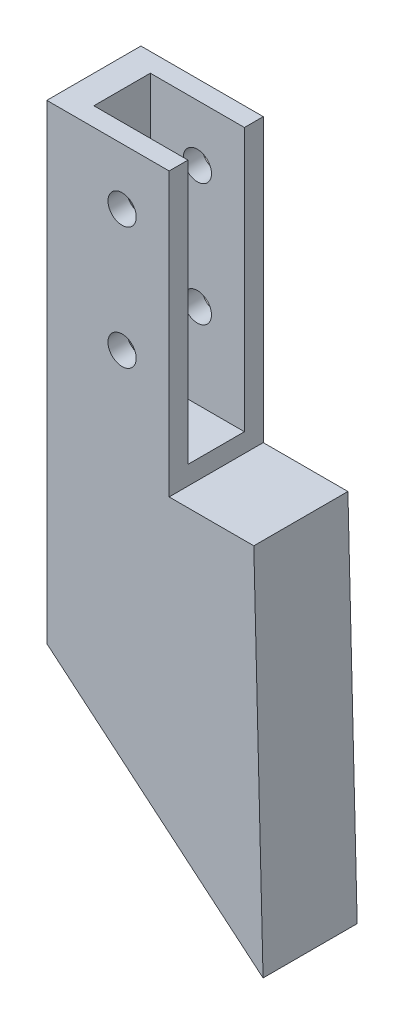
from build123d import *

# Parameters (mm, degrees)
EXTRUDE_1_DEPTH     = 10
SKETCH_2_W          = 6
SKETCH_2_H          = 28
CUT_EXTRUDE_1_DEPTH = 10
SKETCH_3_R          = 1.5
CUT_EXTRUDE_2_DEPTH = 58.605092201
SKETCH_4_R          = 1.5
CUT_EXTRUDE_3_DEPTH = 58.605092201


with BuildPart() as part:
    # 草图1 → 凸台-拉伸1 (new body)
    with BuildSketch(Plane.XY):
        Polygon((15.495607284, -15), (6.5, -15), (6.5, 15), (-6.5, 15), (-6.5, -35), (16.481333294, -54.283628291), align=None)
    extrude(amount=EXTRUDE_1_DEPTH)

    # 草图2 → 切除-拉伸1 (cut)
    with BuildSketch(Plane(origin=(6.5, 0, 0), x_dir=(0, 0, -1), z_dir=(1, 0, 0))):
        with Locations((-5, 1)):
            Rectangle(SKETCH_2_W, SKETCH_2_H)
    extrude(amount=-CUT_EXTRUDE_1_DEPTH, mode=Mode.SUBTRACT)

    # 草图3 → 切除-拉伸2 (cut, through all)
    with BuildSketch(Plane.XY.offset(10)):
        with Locations((1.5, 9)):
            Circle(SKETCH_3_R)
    extrude(amount=-CUT_EXTRUDE_2_DEPTH, mode=Mode.SUBTRACT)

    # 草图4 → 切除-拉伸3 (cut, through all)
    with BuildSketch(Plane.XY.offset(10)):
        with Locations((1.5, -4)):
            Circle(SKETCH_4_R)
    extrude(amount=-CUT_EXTRUDE_3_DEPTH, mode=Mode.SUBTRACT)


solid = part.part
